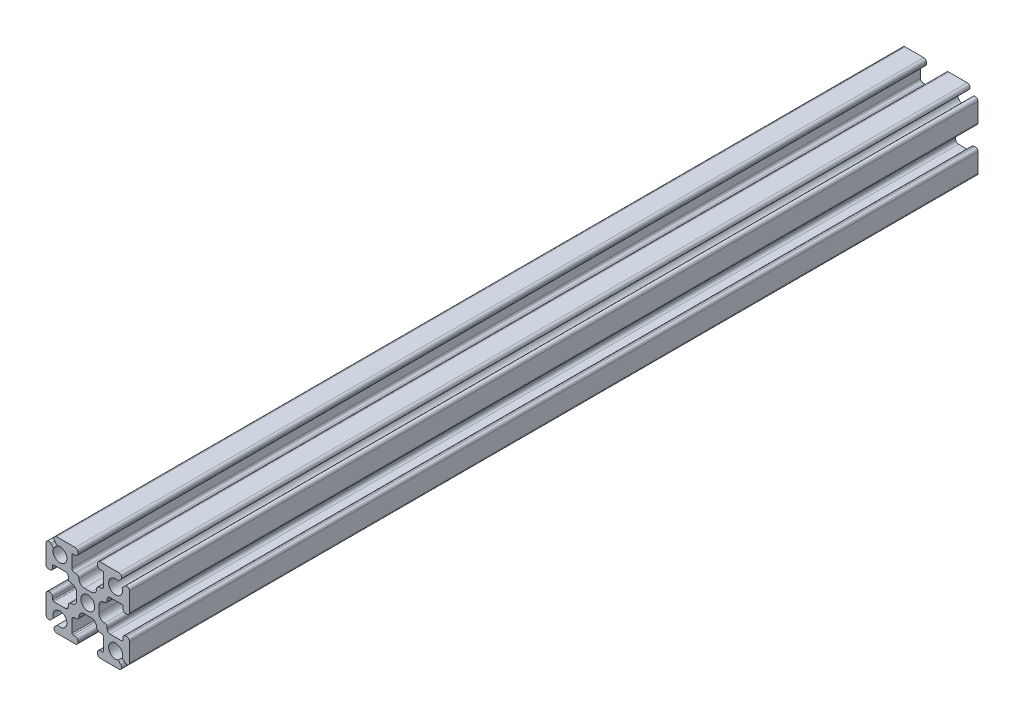
from build123d import *

# Parameters (mm, degrees)
SKETCH1_R           = 1.25
BOSS_EXTRUDE1_DEPTH = 152.4


with BuildPart() as part:
    # Sketch1 → Boss-Extrude1 (new body)
    with BuildSketch(Plane.XY):
        with BuildLine():
            Line((6.646446609, 5.939339828), (6.163645978, 5.456539197))
            ThreePointArc((6.163645978, 5.456539197), (4.116116524, 4.116116524), (5.456539197, 6.163645978))
            Line((5.456539197, 6.163645978), (5.939339828, 6.646446609))
            ThreePointArc((5.939339828, 6.646446609), (6.047726204, 7.191341716), (5.585786438, 7.5))
            Line((5.585786438, 7.5), (2.25, 7.5))
            ThreePointArc((2.25, 7.5), (1.896446609, 7.353553391), (1.75, 7))
            Line((1.75, 7), (1.75, 6.8))
            ThreePointArc((1.75, 6.8), (1.896446609, 6.446446609), (2.25, 6.3))
            Line((2.25, 6.3), (2.65, 6.3))
            ThreePointArc((2.65, 6.3), (2.791421356, 6.241421356), (2.85, 6.1))
            Line((2.85, 6.1), (2.85, 4))
            ThreePointArc((2.85, 4), (2.703553391, 3.646446609), (2.35, 3.5))
            Line((2.35, 3.5), (2.1, 3.5))
            ThreePointArc((2.1, 3.5), (1.746446609, 3.353553391), (1.6, 3))
            ThreePointArc((1.6, 3), (1.307106781, 2.292893219), (0.6, 2))
            Line((0.6, 2), (-0.6, 2))
            ThreePointArc((-0.6, 2), (-1.307106781, 2.292893219), (-1.6, 3))
            ThreePointArc((-1.6, 3), (-1.746446609, 3.353553391), (-2.1, 3.5))
            Line((-2.1, 3.5), (-2.35, 3.5))
            ThreePointArc((-2.35, 3.5), (-2.703553391, 3.646446609), (-2.85, 4))
            Line((-2.85, 4), (-2.85, 6.1))
            ThreePointArc((-2.85, 6.1), (-2.791421356, 6.241421356), (-2.65, 6.3))
            Line((-2.65, 6.3), (-2.25, 6.3))
            ThreePointArc((-2.25, 6.3), (-1.896446609, 6.446446609), (-1.75, 6.8))
            Line((-1.75, 6.8), (-1.75, 7))
            ThreePointArc((-1.75, 7), (-1.896446609, 7.353553391), (-2.25, 7.5))
            Line((-2.25, 7.5), (-5.585786438, 7.5))
            ThreePointArc((-5.585786438, 7.5), (-6.047726204, 7.191341716), (-5.939339828, 6.646446609))
            Line((-5.939339828, 6.646446609), (-5.456539197, 6.163645978))
            ThreePointArc((-5.456539197, 6.163645978), (-4.116116524, 4.116116524), (-6.163645978, 5.456539197))
            Line((-6.163645978, 5.456539197), (-6.646446609, 5.939339828))
            ThreePointArc((-6.646446609, 5.939339828), (-7.191341716, 6.047726204), (-7.5, 5.585786438))
            Line((-7.5, 5.585786438), (-7.5, 2.25))
            ThreePointArc((-7.5, 2.25), (-7.353553391, 1.896446609), (-7, 1.75))
            Line((-7, 1.75), (-6.8, 1.75))
            ThreePointArc((-6.8, 1.75), (-6.446446609, 1.896446609), (-6.3, 2.25))
            Line((-6.3, 2.25), (-6.3, 2.65))
            ThreePointArc((-6.3, 2.65), (-6.241421356, 2.791421356), (-6.1, 2.85))
            Line((-6.1, 2.85), (-4, 2.85))
            ThreePointArc((-4, 2.85), (-3.646446609, 2.703553391), (-3.5, 2.35))
            Line((-3.5, 2.35), (-3.5, 2.1))
            ThreePointArc((-3.5, 2.1), (-3.353553391, 1.746446609), (-3, 1.6))
            ThreePointArc((-3, 1.6), (-2.292893219, 1.307106781), (-2, 0.6))
            Line((-2, 0.6), (-2, -0.6))
            ThreePointArc((-2, -0.6), (-2.292893219, -1.307106781), (-3, -1.6))
            ThreePointArc((-3, -1.6), (-3.353553391, -1.746446609), (-3.5, -2.1))
            Line((-3.5, -2.1), (-3.5, -2.35))
            ThreePointArc((-3.5, -2.35), (-3.646446609, -2.703553391), (-4, -2.85))
            Line((-4, -2.85), (-6.1, -2.85))
            ThreePointArc((-6.1, -2.85), (-6.241421356, -2.791421356), (-6.3, -2.65))
            Line((-6.3, -2.65), (-6.3, -2.25))
            ThreePointArc((-6.3, -2.25), (-6.446446609, -1.896446609), (-6.8, -1.75))
            Line((-6.8, -1.75), (-7, -1.75))
            ThreePointArc((-7, -1.75), (-7.353553391, -1.896446609), (-7.5, -2.25))
            Line((-7.5, -2.25), (-7.5, -5.585786438))
            ThreePointArc((-7.5, -5.585786438), (-7.191341716, -6.047726204), (-6.646446609, -5.939339828))
            Line((-6.646446609, -5.939339828), (-6.163645978, -5.456539197))
            ThreePointArc((-6.163645978, -5.456539197), (-4.116116524, -4.116116524), (-5.456539197, -6.163645978))
            Line((-5.456539197, -6.163645978), (-5.939339828, -6.646446609))
            ThreePointArc((-5.939339828, -6.646446609), (-6.047726204, -7.191341716), (-5.585786438, -7.5))
            Line((-5.585786438, -7.5), (-2.25, -7.5))
            ThreePointArc((-2.25, -7.5), (-1.896446609, -7.353553391), (-1.75, -7))
            Line((-1.75, -7), (-1.75, -6.8))
            ThreePointArc((-1.75, -6.8), (-1.896446609, -6.446446609), (-2.25, -6.3))
            Line((-2.25, -6.3), (-2.65, -6.3))
            ThreePointArc((-2.65, -6.3), (-2.791421356, -6.241421356), (-2.85, -6.1))
            Line((-2.85, -6.1), (-2.85, -4))
            ThreePointArc((-2.85, -4), (-2.703553391, -3.646446609), (-2.35, -3.5))
            Line((-2.35, -3.5), (-2.1, -3.5))
            ThreePointArc((-2.1, -3.5), (-1.746446609, -3.353553391), (-1.6, -3))
            ThreePointArc((-1.6, -3), (-1.307106781, -2.292893219), (-0.6, -2))
            Line((-0.6, -2), (0.6, -2))
            ThreePointArc((0.6, -2), (1.307106781, -2.292893219), (1.6, -3))
            ThreePointArc((1.6, -3), (1.746446609, -3.353553391), (2.1, -3.5))
            Line((2.1, -3.5), (2.35, -3.5))
            ThreePointArc((2.35, -3.5), (2.703553391, -3.646446609), (2.85, -4))
            Line((2.85, -4), (2.85, -6.1))
            ThreePointArc((2.85, -6.1), (2.791421356, -6.241421356), (2.65, -6.3))
            Line((2.65, -6.3), (2.25, -6.3))
            ThreePointArc((2.25, -6.3), (1.896446609, -6.446446609), (1.75, -6.8))
            Line((1.75, -6.8), (1.75, -7))
            ThreePointArc((1.75, -7), (1.896446609, -7.353553391), (2.25, -7.5))
            Line((2.25, -7.5), (5.585786438, -7.5))
            ThreePointArc((5.585786438, -7.5), (6.047726204, -7.191341716), (5.939339828, -6.646446609))
            Line((5.939339828, -6.646446609), (5.456539197, -6.163645978))
            ThreePointArc((5.456539197, -6.163645978), (4.116116524, -4.116116524), (6.163645978, -5.456539197))
            Line((6.163645978, -5.456539197), (6.646446609, -5.939339828))
            ThreePointArc((6.646446609, -5.939339828), (7.191341716, -6.047726204), (7.5, -5.585786438))
            Line((7.5, -5.585786438), (7.5, -2.25))
            ThreePointArc((7.5, -2.25), (7.353553391, -1.896446609), (7, -1.75))
            Line((7, -1.75), (6.8, -1.75))
            ThreePointArc((6.8, -1.75), (6.446446609, -1.896446609), (6.3, -2.25))
            Line((6.3, -2.25), (6.3, -2.65))
            ThreePointArc((6.3, -2.65), (6.241421356, -2.791421356), (6.1, -2.85))
            Line((6.1, -2.85), (4, -2.85))
            ThreePointArc((4, -2.85), (3.646446609, -2.703553391), (3.5, -2.35))
            Line((3.5, -2.35), (3.5, -2.1))
            ThreePointArc((3.5, -2.1), (3.353553391, -1.746446609), (3, -1.6))
            ThreePointArc((3, -1.6), (2.292893219, -1.307106781), (2, -0.6))
            Line((2, -0.6), (2, 0.6))
            ThreePointArc((2, 0.6), (2.292893219, 1.307106781), (3, 1.6))
            ThreePointArc((3, 1.6), (3.353553391, 1.746446609), (3.5, 2.1))
            Line((3.5, 2.1), (3.5, 2.35))
            ThreePointArc((3.5, 2.35), (3.646446609, 2.703553391), (4, 2.85))
            Line((4, 2.85), (6.1, 2.85))
            ThreePointArc((6.1, 2.85), (6.241421356, 2.791421356), (6.3, 2.65))
            Line((6.3, 2.65), (6.3, 2.25))
            ThreePointArc((6.3, 2.25), (6.446446609, 1.896446609), (6.8, 1.75))
            Line((6.8, 1.75), (7, 1.75))
            ThreePointArc((7, 1.75), (7.353553391, 1.896446609), (7.5, 2.25))
            Line((7.5, 2.25), (7.5, 5.585786438))
            ThreePointArc((7.5, 5.585786438), (7.191341716, 6.047726204), (6.646446609, 5.939339828))
        make_face()
        Circle(SKETCH1_R, mode=Mode.SUBTRACT)
    extrude(amount=BOSS_EXTRUDE1_DEPTH)


solid = part.part
